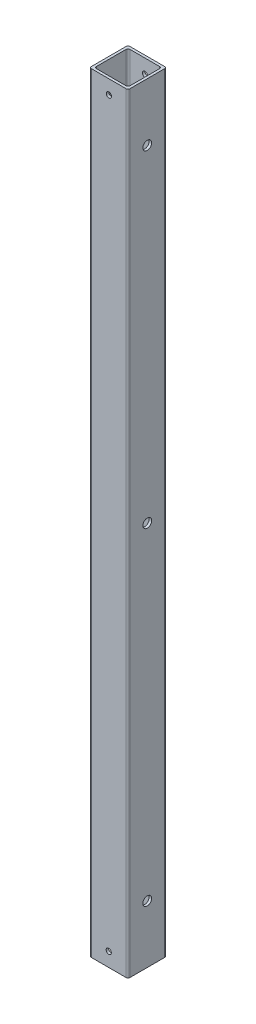
from build123d import *

# Parameters (mm, degrees)
SKETCH1_W                  = 25.4
SKETCH1_H                  = 25.4
SKETCH1_W_2                = 22.098
SKETCH1_H_2                = 22.098
BOSS_EXTRUDE1_DEPTH        = 508
FILLET1_R                  = 1.27
F_1_0_228_DIAMETER_HOLE2_D = 5.7912
F_8_32_TAPPED_HOLE1_D      = 3.4544


with BuildPart() as part:
    # Sketch1 → Boss-Extrude1 (new body)
    with BuildSketch(Plane(origin=(0, 0, 0), x_dir=(1, 0, 0), z_dir=(0, 1, 0))):
        Rectangle(SKETCH1_W, SKETCH1_H)
        Rectangle(SKETCH1_W_2, SKETCH1_H_2, mode=Mode.SUBTRACT)
    extrude(amount=BOSS_EXTRUDE1_DEPTH)

    # Fillet1
    fillet1_edges = [part.edges().sort_by_distance(p)[0] for p in [
        (-12.7, 254, 12.7),
        (-12.7, 254, -12.7),
        (12.7, 254, -12.7),
        (12.7, 254, 12.7),
        (-11.049, 254, -11.049),
        (11.049, 254, 11.049),
        (11.049, 254, -11.049),
        (-11.049, 254, 11.049),
    ]]
    fillet(fillet1_edges, radius=FILLET1_R)

    # #1 (0.228) Diameter Hole2 (through all)
    with Locations(Plane.ZY.offset(12.7)):
        with Locations((0, 469.9), (0, 254), (0, 38.1)):
            Hole(F_1_0_228_DIAMETER_HOLE2_D / 2)

    # #8-32 Tapped Hole1 (through all)
    with Locations(Plane.XY.offset(12.7)):
        with Locations((0, 9.271), (0.103095802, 498.729)):
            Hole(F_8_32_TAPPED_HOLE1_D / 2)


solid = part.part
